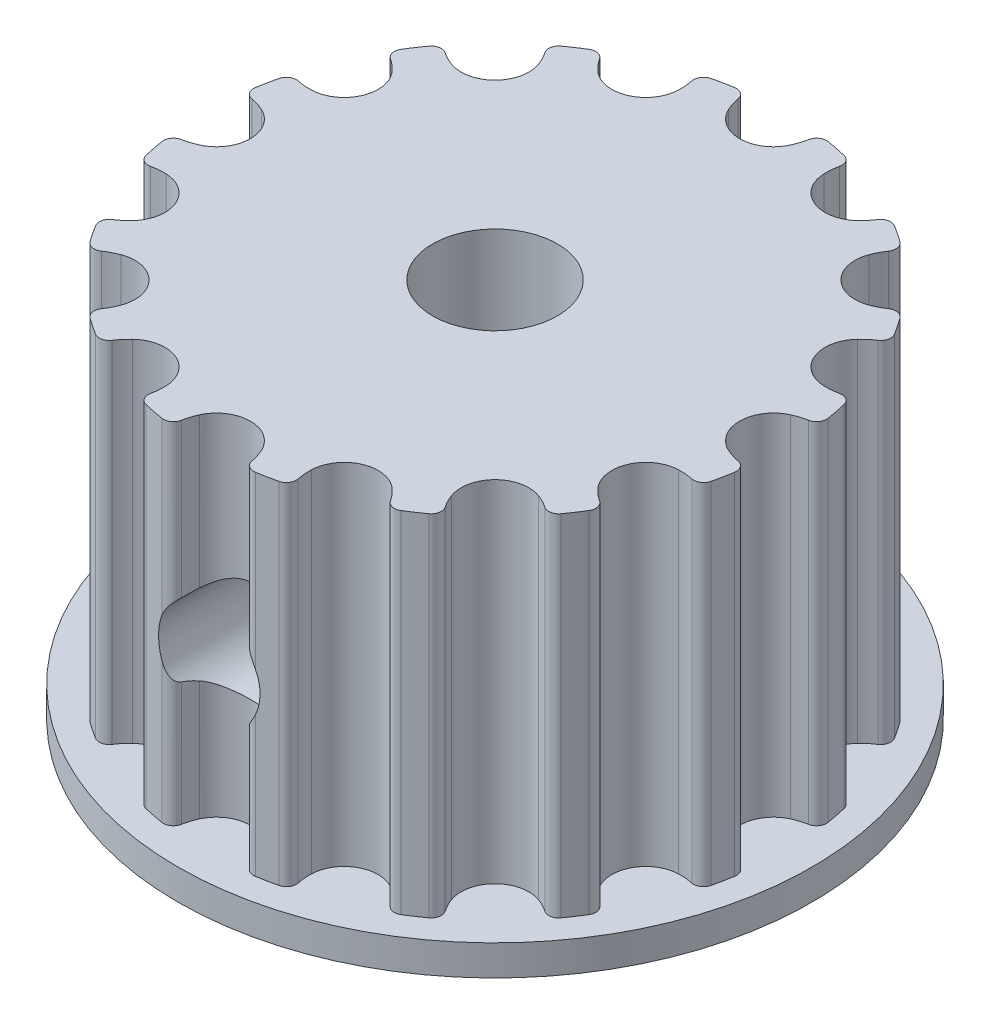
from build123d import *

# Parameters (mm, degrees)
SKETCH1_R               = 1.5625
BOSS_EXTRUDE1_DEPTH     = 4.7625
SKETCH2_R               = 7.9375
SKETCH2_R_2             = 1.5625
BOSS_EXTRUDE2_DEPTH     = 0.762
CUT_EXTRUDE3_DEPTH      = 13.193818875
CUT_EXTRUDE3_DEPTH_BACK = 13.193818875
SKETCH5_R               = 1.27


with BuildPart() as part:
    # Sketch1 → Boss-Extrude1 (new, symmetric)
    with BuildSketch(Plane(origin=(0, 0, 0), x_dir=(1, 0, 0), z_dir=(0, 1, 0))):
        with BuildLine():
            ThreePointArc((-1.850768, -6.777037356), (-1.816941892, -6.962421006), (-1.663291889, -7.071521784))
            ThreePointArc((-1.663291889, -7.071521784), (-1.417233644, -7.124914669), (-1.169472895, -7.169748489))
            ThreePointArc((-1.169472895, -7.169748489), (-0.985767742, -7.127751824), (-0.883573242, -6.969424355))
            ThreePointArc((-0.883573242, -6.969424355), (-0.839120956, -6.792881518), (-0.773880597, -6.622919538))
            ThreePointArc((-0.773880597, -6.622919538), (0, -6.1245), (0.773880597, -6.622919538))
            ThreePointArc((0.773880597, -6.622919538), (0.839120956, -6.792881518), (0.883573242, -6.969424355))
            ThreePointArc((0.883573242, -6.969424355), (0.985767742, -7.127751824), (1.169472895, -7.169748489))
            ThreePointArc((1.169472895, -7.169748489), (1.417233644, -7.124914669), (1.663291889, -7.071521784))
            ThreePointArc((1.663291889, -7.071521784), (1.816941892, -6.962421006), (1.850768, -6.777037356))
            ThreePointArc((1.850768, -6.777037356), (1.824276538, -6.596921889), (1.819509137, -6.414931089))
            ThreePointArc((1.819509137, -6.414931089), (2.343744682, -5.658300197), (3.249454025, -5.822628523))
            ThreePointArc((3.249454025, -5.822628523), (3.374769892, -5.954686513), (3.483398468, -6.100779674))
            ThreePointArc((3.483398468, -6.100779674), (3.638403174, -6.20794704), (3.824196033, -6.176445981))
            ThreePointArc((3.824196033, -6.176445981), (4.035939958, -6.040210999), (4.242835561, -5.896719991))
            ThreePointArc((4.242835561, -5.896719991), (4.343038594, -5.737124705), (4.303346591, -5.552907854))
            ThreePointArc((4.303346591, -5.552907854), (4.209944466, -5.396640704), (4.135895098, -5.230327534))
            ThreePointArc((4.135895098, -5.230327534), (4.330675481, -4.330675481), (5.230327534, -4.135895098))
            ThreePointArc((5.230327534, -4.135895098), (5.396640704, -4.209944466), (5.552907854, -4.303346591))
            ThreePointArc((5.552907854, -4.303346591), (5.737124705, -4.343038594), (5.896719991, -4.242835561))
            ThreePointArc((5.896719991, -4.242835561), (6.040210999, -4.035939958), (6.176445981, -3.824196033))
            ThreePointArc((6.176445981, -3.824196033), (6.20794704, -3.638403174), (6.100779674, -3.483398468))
            ThreePointArc((6.100779674, -3.483398468), (5.954686513, -3.374769892), (5.822628523, -3.249454025))
            ThreePointArc((5.822628523, -3.249454025), (5.658300197, -2.343744682), (6.414931089, -1.819509137))
            ThreePointArc((6.414931089, -1.819509137), (6.596921889, -1.824276538), (6.777037356, -1.850768))
            ThreePointArc((6.777037356, -1.850768), (6.962421006, -1.816941892), (7.071521784, -1.663291889))
            ThreePointArc((7.071521784, -1.663291889), (7.124914669, -1.417233644), (7.169748489, -1.169472895))
            ThreePointArc((7.169748489, -1.169472895), (7.127751824, -0.985767742), (6.969424355, -0.883573242))
            ThreePointArc((6.969424355, -0.883573242), (6.792881518, -0.839120956), (6.622919538, -0.773880597))
            ThreePointArc((6.622919538, -0.773880597), (6.1245, 0), (6.622919538, 0.773880597))
            ThreePointArc((6.622919538, 0.773880597), (6.792881518, 0.839120956), (6.969424355, 0.883573242))
            ThreePointArc((6.969424355, 0.883573242), (7.127751824, 0.985767742), (7.169748489, 1.169472895))
            ThreePointArc((7.169748489, 1.169472895), (7.124914669, 1.417233644), (7.071521784, 1.663291889))
            ThreePointArc((7.071521784, 1.663291889), (6.962421006, 1.816941892), (6.777037356, 1.850768))
            ThreePointArc((6.777037356, 1.850768), (6.596921889, 1.824276538), (6.414931089, 1.819509137))
            ThreePointArc((6.414931089, 1.819509137), (5.658300197, 2.343744682), (5.822628523, 3.249454025))
            ThreePointArc((5.822628523, 3.249454025), (5.954686513, 3.374769892), (6.100779674, 3.483398468))
            ThreePointArc((6.100779674, 3.483398468), (6.20794704, 3.638403174), (6.176445981, 3.824196033))
            ThreePointArc((6.176445981, 3.824196033), (6.040210999, 4.035939958), (5.896719991, 4.242835561))
            ThreePointArc((5.896719991, 4.242835561), (5.737124705, 4.343038594), (5.552907854, 4.303346591))
            ThreePointArc((5.552907854, 4.303346591), (5.396640704, 4.209944466), (5.230327534, 4.135895098))
            ThreePointArc((5.230327534, 4.135895098), (4.330675481, 4.330675481), (4.135895098, 5.230327534))
            ThreePointArc((4.135895098, 5.230327534), (4.209944466, 5.396640704), (4.303346591, 5.552907854))
            ThreePointArc((4.303346591, 5.552907854), (4.343038594, 5.737124705), (4.242835561, 5.896719991))
            ThreePointArc((4.242835561, 5.896719991), (4.035939958, 6.040210999), (3.824196033, 6.176445981))
            ThreePointArc((3.824196033, 6.176445981), (3.638403174, 6.20794704), (3.483398468, 6.100779674))
            ThreePointArc((3.483398468, 6.100779674), (3.374769892, 5.954686513), (3.249454025, 5.822628523))
            ThreePointArc((3.249454025, 5.822628523), (2.343744682, 5.658300197), (1.819509137, 6.414931089))
            ThreePointArc((1.819509137, 6.414931089), (1.824276538, 6.596921889), (1.850768, 6.777037356))
            ThreePointArc((1.850768, 6.777037356), (1.816941892, 6.962421006), (1.663291889, 7.071521784))
            ThreePointArc((1.663291889, 7.071521784), (1.417233644, 7.124914669), (1.169472895, 7.169748489))
            ThreePointArc((1.169472895, 7.169748489), (0.985767742, 7.127751824), (0.883573242, 6.969424355))
            ThreePointArc((0.883573242, 6.969424355), (0.839120956, 6.792881518), (0.773880597, 6.622919538))
            ThreePointArc((0.773880597, 6.622919538), (0, 6.1245), (-0.773880597, 6.622919538))
            ThreePointArc((-0.773880597, 6.622919538), (-0.839120956, 6.792881518), (-0.883573242, 6.969424355))
            ThreePointArc((-0.883573242, 6.969424355), (-0.985767742, 7.127751824), (-1.169472895, 7.169748489))
            ThreePointArc((-1.169472895, 7.169748489), (-1.417233644, 7.124914669), (-1.663291889, 7.071521784))
            ThreePointArc((-1.663291889, 7.071521784), (-1.816941892, 6.962421006), (-1.850768, 6.777037356))
            ThreePointArc((-1.850768, 6.777037356), (-1.824276538, 6.596921889), (-1.819509137, 6.414931089))
            ThreePointArc((-1.819509137, 6.414931089), (-2.343744682, 5.658300197), (-3.249454025, 5.822628523))
            ThreePointArc((-3.249454025, 5.822628523), (-3.374769892, 5.954686513), (-3.483398468, 6.100779674))
            ThreePointArc((-3.483398468, 6.100779674), (-3.638403174, 6.20794704), (-3.824196033, 6.176445981))
            ThreePointArc((-3.824196033, 6.176445981), (-4.035939958, 6.040210999), (-4.242835561, 5.896719991))
            ThreePointArc((-4.242835561, 5.896719991), (-4.343038594, 5.737124705), (-4.303346591, 5.552907854))
            ThreePointArc((-4.303346591, 5.552907854), (-4.209944466, 5.396640704), (-4.135895098, 5.230327534))
            ThreePointArc((-4.135895098, 5.230327534), (-4.330675481, 4.330675481), (-5.230327534, 4.135895098))
            ThreePointArc((-5.230327534, 4.135895098), (-5.396640704, 4.209944466), (-5.552907854, 4.303346591))
            ThreePointArc((-5.552907854, 4.303346591), (-5.737124705, 4.343038594), (-5.896719991, 4.242835561))
            ThreePointArc((-5.896719991, 4.242835561), (-6.040210999, 4.035939958), (-6.176445981, 3.824196033))
            ThreePointArc((-6.176445981, 3.824196033), (-6.20794704, 3.638403174), (-6.100779674, 3.483398468))
            ThreePointArc((-6.100779674, 3.483398468), (-5.954686513, 3.374769892), (-5.822628523, 3.249454025))
            ThreePointArc((-5.822628523, 3.249454025), (-5.658300197, 2.343744682), (-6.414931089, 1.819509137))
            ThreePointArc((-6.414931089, 1.819509137), (-6.596921889, 1.824276538), (-6.777037356, 1.850768))
            ThreePointArc((-6.777037356, 1.850768), (-6.962421006, 1.816941892), (-7.071521784, 1.663291889))
            ThreePointArc((-7.071521784, 1.663291889), (-7.124914669, 1.417233644), (-7.169748489, 1.169472895))
            ThreePointArc((-7.169748489, 1.169472895), (-7.127751824, 0.985767742), (-6.969424355, 0.883573242))
            ThreePointArc((-6.969424355, 0.883573242), (-6.792881518, 0.839120956), (-6.622919538, 0.773880597))
            ThreePointArc((-6.622919538, 0.773880597), (-6.1245, 0), (-6.622919538, -0.773880597))
            ThreePointArc((-6.622919538, -0.773880597), (-6.792881518, -0.839120956), (-6.969424355, -0.883573242))
            ThreePointArc((-6.969424355, -0.883573242), (-7.127751824, -0.985767742), (-7.169748489, -1.169472895))
            ThreePointArc((-7.169748489, -1.169472895), (-7.124914669, -1.417233644), (-7.071521784, -1.663291889))
            ThreePointArc((-7.071521784, -1.663291889), (-6.962421006, -1.816941892), (-6.777037356, -1.850768))
            ThreePointArc((-6.777037356, -1.850768), (-6.596921889, -1.824276538), (-6.414931089, -1.819509137))
            ThreePointArc((-6.414931089, -1.819509137), (-5.658300197, -2.343744682), (-5.822628523, -3.249454025))
            ThreePointArc((-5.822628523, -3.249454025), (-5.954686513, -3.374769892), (-6.100779674, -3.483398468))
            ThreePointArc((-6.100779674, -3.483398468), (-6.20794704, -3.638403174), (-6.176445981, -3.824196033))
            ThreePointArc((-6.176445981, -3.824196033), (-6.040210999, -4.035939958), (-5.896719991, -4.242835561))
            ThreePointArc((-5.896719991, -4.242835561), (-5.737124705, -4.343038594), (-5.552907854, -4.303346591))
            ThreePointArc((-5.552907854, -4.303346591), (-5.396640704, -4.209944466), (-5.230327534, -4.135895098))
            ThreePointArc((-5.230327534, -4.135895098), (-4.330675481, -4.330675481), (-4.135895098, -5.230327534))
            ThreePointArc((-4.135895098, -5.230327534), (-4.209944466, -5.396640704), (-4.303346591, -5.552907854))
            ThreePointArc((-4.303346591, -5.552907854), (-4.343038594, -5.737124705), (-4.242835561, -5.896719991))
            ThreePointArc((-4.242835561, -5.896719991), (-4.035939958, -6.040210999), (-3.824196033, -6.176445981))
            ThreePointArc((-3.824196033, -6.176445981), (-3.638403174, -6.20794704), (-3.483398468, -6.100779674))
            ThreePointArc((-3.483398468, -6.100779674), (-3.374769892, -5.954686513), (-3.249454025, -5.822628523))
            ThreePointArc((-3.249454025, -5.822628523), (-2.343744682, -5.658300197), (-1.819509137, -6.414931089))
            ThreePointArc((-1.819509137, -6.414931089), (-1.824276538, -6.596921889), (-1.850768, -6.777037356))
        make_face()
        Circle(SKETCH1_R, mode=Mode.SUBTRACT)
    extrude(amount=BOSS_EXTRUDE1_DEPTH, both=True)

    # Sketch2 → Boss-Extrude2 (add)
    with BuildSketch(Plane.XZ.offset(4.7625)):
        Circle(SKETCH2_R)
        Circle(SKETCH2_R_2, mode=Mode.SUBTRACT)
    extrude(amount=-BOSS_EXTRUDE2_DEPTH)

    # Sketch5 → Cut-Extrude3 (cut, two sides: drawn at the far end of the back side and taken through both)
    with BuildSketch(Plane.XY.offset(-CUT_EXTRUDE3_DEPTH_BACK)):
        Circle(SKETCH5_R)
    extrude(amount=CUT_EXTRUDE3_DEPTH + CUT_EXTRUDE3_DEPTH_BACK, mode=Mode.SUBTRACT)


solid = part.part
